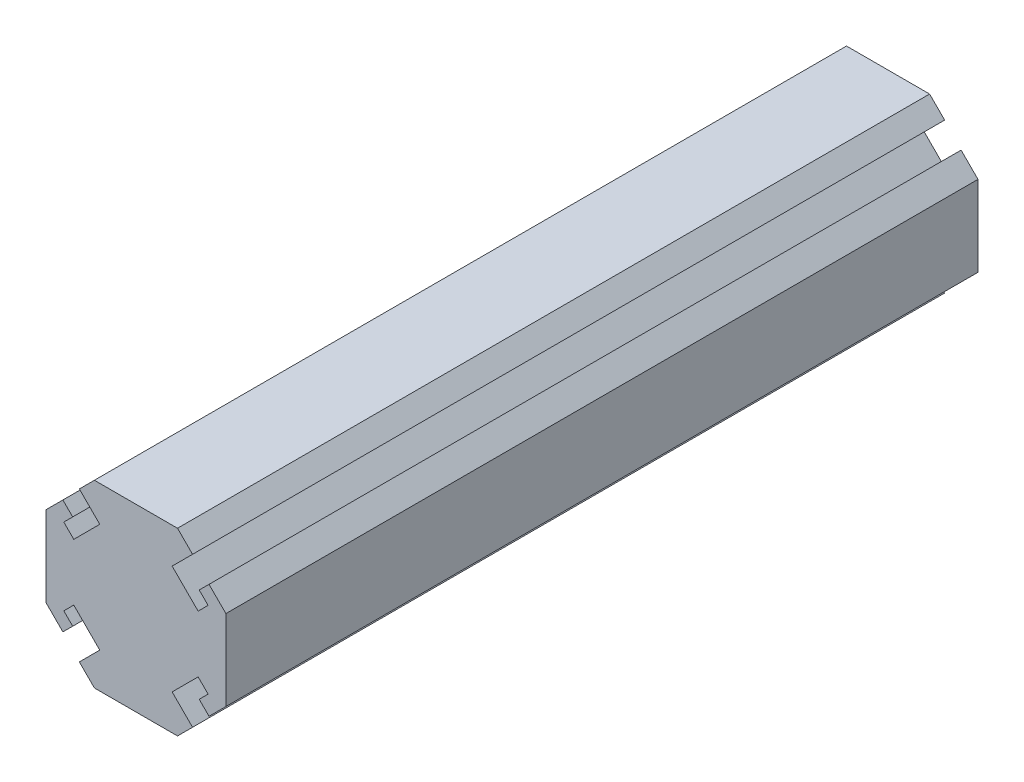
from build123d import *

# Parameters (mm, degrees)
EXTRUDE_1_DEPTH = 300


with BuildPart() as part:
    # Эскиз1 → Бобышка-Вытянуть1 (new body)
    with BuildSketch(Plane.XY):
        Polygon((-31.085887615, 16.055441354), (-31.085887615, -16.055441354), (-24.35172929, -22.789599679), (-20.441141742, -18.879012131), (-23.987696835, -15.332457037), (-20.009873593, -11.354633795), (-9.637468813, -21.727038576), (-17.78766152, -29.877231283), (-11.783187518, -35.881705285), (21.371951539, -35.881705285), (27.376425541, -29.877231283), (19.226232834, -21.727038576), (29.598637614, -11.354633795), (33.576460856, -15.332457037), (30.029905763, -18.879012131), (33.940493312, -22.789599679), (40.674651637, -16.055441354), (40.674651637, 16.055441354), (33.940493312, 22.789599679), (30.029905763, 18.879012131), (33.576460856, 15.332457037), (29.598637614, 11.354633795), (19.226232834, 21.727038576), (27.376425541, 29.877231283), (21.371951539, 35.881705285), (-11.783187518, 35.881705285), (-17.78766152, 29.877231283), (-9.637468813, 21.727038576), (-20.009873593, 11.354633795), (-23.987696835, 15.332457037), (-20.441141742, 18.879012131), (-24.35172929, 22.789599679), align=None)
    extrude(amount=-EXTRUDE_1_DEPTH)


solid = part.part
